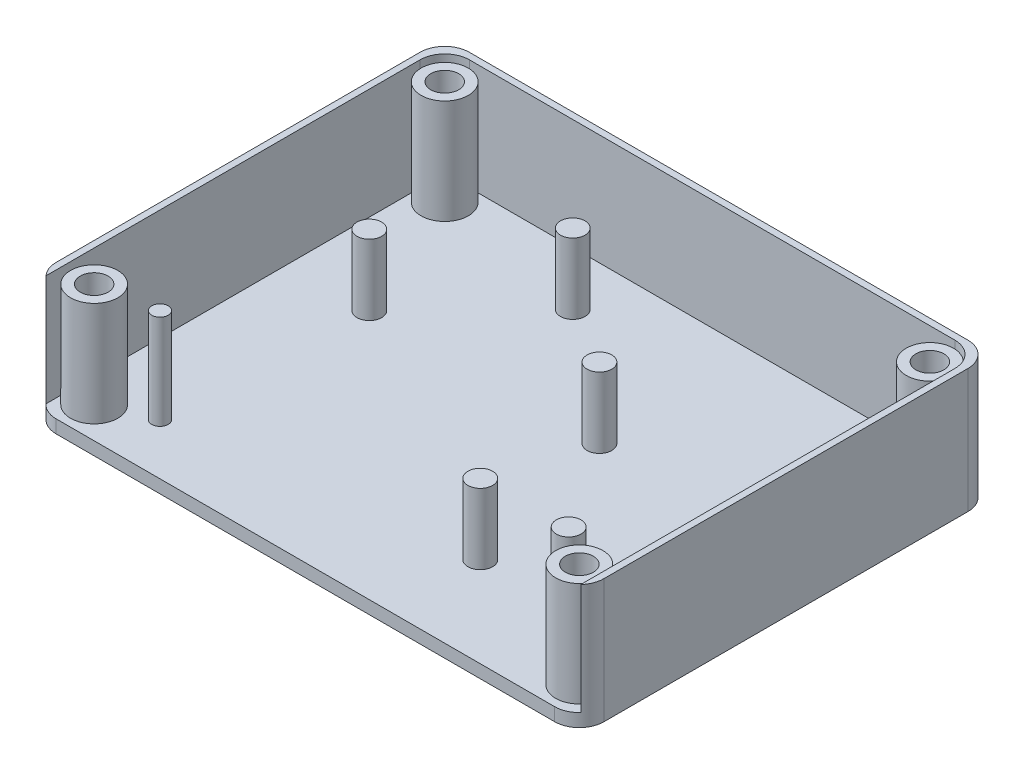
from build123d import *

# Parameters (mm, degrees)
BOSS_EXTRUDE12_DEPTH = 3.175
BOSS_EXTRUDE13_DEPTH = 30.1625
SKETCH1_25_R         = 5.75
SKETCH1_25_R_2       = 3.4
BOSS_EXTRUDE15_DEPTH = 28.575
SKETCH1_27_R         = 3.4
CUT_EXTRUDE3_DEPTH   = 28.575
CHAMFER2_SIZE        = 1.45
SKETCH1_28_R         = 3
BOSS_EXTRUDE16_DEPTH = 20.32
SKETCH1_29_R         = 2
BOSS_EXTRUDE17_DEPTH = 26.1874
FILLET3_R            = 6


with BuildPart() as part:
    # Sketch1 → Boss-Extrude12 (new body)
    with BuildSketch(Plane(origin=(0, 0, 0), x_dir=(1, 0, 0), z_dir=(0, 1, 0))):
        with BuildLine():
            Line((-66.858315384, -50.276221126), (-65.270815384, -50.276221126))
            Line((-65.270815384, -50.276221126), (64.85543465, -50.276221126))
            Line((64.85543465, -50.276221126), (66.44293465, -50.276221126))
            Line((66.44293465, -50.276221126), (66.44293465, 44.266274766))
            ThreePointArc((66.44293465, 44.266274766), (64.685575338, 48.508915454), (60.44293465, 50.266274766))
            Line((60.44293465, 50.266274766), (-60.858315384, 50.266274766))
            ThreePointArc((-60.858315384, 50.266274766), (-65.100956071, 48.508915454), (-66.858315384, 44.266274766))
            Line((-66.858315384, 44.266274766), (-66.858315384, -50.276221126))
        make_face()
    extrude(amount=BOSS_EXTRUDE12_DEPTH)

    # Sketch1<23> → Boss-Extrude13 (add)
    with BuildSketch(Plane(origin=(0, 0, 0), x_dir=(1, 0, 0), z_dir=(0, 1, 0))):
        with BuildLine():
            Line((-66.858315384, 44.266274766), (-66.858315384, -50.276221126))
            Line((-66.858315384, -50.276221126), (-65.270815384, -50.276221126))
            Line((-65.270815384, -50.276221126), (-65.270815384, 42.678774766))
            ThreePointArc((-65.270815384, 42.678774766), (-63.513456071, 46.921415454), (-59.270815384, 48.678774766))
            Line((-59.270815384, 48.678774766), (58.85543465, 48.678774766))
            ThreePointArc((58.85543465, 48.678774766), (63.098075338, 46.921415454), (64.85543465, 42.678774766))
            Line((64.85543465, 42.678774766), (64.85543465, -50.276221126))
            Line((64.85543465, -50.276221126), (66.44293465, -50.276221126))
            Line((66.44293465, -50.276221126), (66.44293465, 44.266274766))
            ThreePointArc((66.44293465, 44.266274766), (64.685575338, 48.508915454), (60.44293465, 50.266274766))
            Line((60.44293465, 50.266274766), (-60.858315384, 50.266274766))
            ThreePointArc((-60.858315384, 50.266274766), (-65.100956071, 48.508915454), (-66.858315384, 44.266274766))
        make_face()
    extrude(amount=BOSS_EXTRUDE13_DEPTH)

    # Sketch1<25> → Boss-Extrude15 (add)
    # profile 1 of 4: a face of its own
    with BuildSketch(Plane(origin=(0, 0, 0), x_dir=(1, 0, 0), z_dir=(0, 1, 0))):
        with Locations((-59.238315384, 42.646274766)):
            Circle(SKETCH1_25_R)
        with Locations((-59.238315384, 42.646274766)):
            Circle(SKETCH1_25_R_2, mode=Mode.SUBTRACT)
    # profile 2 of 4: a face of its own
    with BuildSketch(Plane(origin=(0, 0, 0), x_dir=(1, 0, 0), z_dir=(0, 1, 0))):
        with Locations((58.82293465, 42.646274766)):
            Circle(SKETCH1_25_R)
        with Locations((58.82293465, 42.646274766)):
            Circle(SKETCH1_25_R_2, mode=Mode.SUBTRACT)
    # profile 3 of 4: a face of its own
    with BuildSketch(Plane(origin=(0, 0, 0), x_dir=(1, 0, 0), z_dir=(0, 1, 0))):
        with Locations((-59.238315384, -42.656221126)):
            Circle(SKETCH1_25_R)
        with Locations((-59.238315384, -42.656221126)):
            Circle(SKETCH1_25_R_2, mode=Mode.SUBTRACT)
    # profile 4 of 4: a face of its own
    with BuildSketch(Plane(origin=(0, 0, 0), x_dir=(1, 0, 0), z_dir=(0, 1, 0))):
        with Locations((58.82293465, -42.656221126)):
            Circle(SKETCH1_25_R)
        with Locations((58.82293465, -42.656221126)):
            Circle(SKETCH1_25_R_2, mode=Mode.SUBTRACT)
    extrude(amount=BOSS_EXTRUDE15_DEPTH)

    # Sketch1<27> → Cut-Extrude3 (cut)
    with BuildSketch(Plane(origin=(0, 0, 0), x_dir=(1, 0, 0), z_dir=(0, 1, 0))):
        with Locations((-59.238315384, 42.646274766)):
            Circle(SKETCH1_27_R)
        with Locations((58.82293465, 42.646274766)):
            Circle(SKETCH1_27_R)
        with Locations((-59.238315384, -42.656221126)):
            Circle(SKETCH1_27_R)
        with Locations((58.82293465, -42.656221126)):
            Circle(SKETCH1_27_R)
    extrude(amount=CUT_EXTRUDE3_DEPTH, mode=Mode.SUBTRACT)

    # Chamfer2
    chamfer2_edges = [part.edges().sort_by_distance(p)[0] for p in [
        (55.42293465, 0, 42.656221126),
        (55.42293465, 0, -42.646274766),
        (-62.638315384, 0, 42.656221126),
        (-62.638315384, 0, -42.646274766),
    ]]
    chamfer(chamfer2_edges, length=CHAMFER2_SIZE)

    # Sketch1<28> → Boss-Extrude16 (add)
    with BuildSketch(Plane(origin=(0, 0, 0), x_dir=(1, 0, 0), z_dir=(0, 1, 0))):
        with Locations((-21.087205302, 35.652944211)):
            Circle(SKETCH1_28_R)
        with Locations((20.412794756, -28.347055805)):
            Circle(SKETCH1_28_R)
        with Locations((-45.587205324, 10.652944173)):
            Circle(SKETCH1_28_R)
        with Locations((10.41279469, 10.652944173)):
            Circle(SKETCH1_28_R)
        with Locations((41.412794666, -27.847055789)):
            Circle(SKETCH1_28_R)
    extrude(amount=BOSS_EXTRUDE16_DEPTH)

    # Sketch1<29> → Boss-Extrude17 (add)
    with BuildSketch(Plane(origin=(0, 0, 0), x_dir=(1, 0, 0), z_dir=(0, 1, 0))):
        with Locations((-48.051200616, -37.823742724)):
            Circle(SKETCH1_29_R)
    extrude(amount=BOSS_EXTRUDE17_DEPTH)

    # Fillet3
    fillet3_edges = [part.edges().sort_by_distance(p)[0] for p in [
        (66.44293465, 15.08125, 50.276221126),
        (-66.858315384, 15.08125, 50.276221126),
    ]]
    fillet(fillet3_edges, radius=FILLET3_R)


solid = part.part
